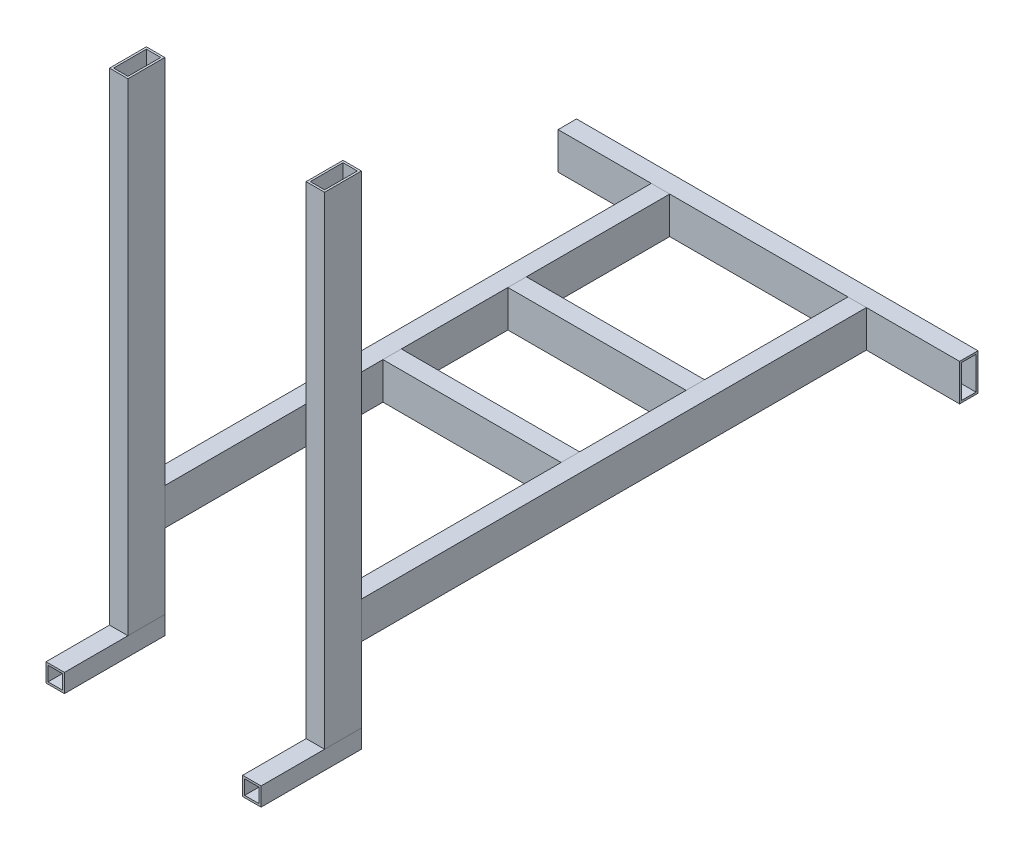
from build123d import *

# Parameters (mm, degrees)
SIGPROFILE_START                    = -45
SIGPROFILE_SIGMA9045_1_DEPTH        = 90
SIGPROFILE_SIGMA9045_1_2_DEPTH      = 5
SIGPROFILE_START_2                  = 40
SIGPROFILE_SIGMA9045_1_3_DEPTH      = 5
SIGPROFILE_SIGMA9045_1_4_DEPTH      = 90
SIGPROFILE_SIGMA9045_1_5_DEPTH      = 5
SIGPROFILE_SIGMA9045_1_6_DEPTH      = 5
SIGPROFILE_SIGMA9045_1_7_OUTLINE_W  = 5
SIGPROFILE_SIGMA9045_1_7_OUTLINE_H  = 1232.5
SIGPROFILE_SIGMA9045_1_7_DEPTH      = 90
SIGPROFILE_SIGMA9045_1_8_OUTLINE_W  = 35
SIGPROFILE_SIGMA9045_1_8_OUTLINE_H  = 1232.5
SIGPROFILE_SIGMA9045_1_8_DEPTH      = 5
SIGPROFILE_SIGMA9045_1_9_OUTLINE_W  = 35
SIGPROFILE_SIGMA9045_1_9_OUTLINE_H  = 1232.5
SIGPROFILE_SIGMA9045_1_9_DEPTH      = 5
SIGPROFILE_START_3                  = -372.5
SIGPROFILE_SIGMA9045_1_10_OUTLINE_W = 980
SIGPROFILE_SIGMA9045_1_10_OUTLINE_H = 90
SIGPROFILE_SIGMA9045_1_10_DEPTH     = 5
SIGPROFILE_START_4                  = -332.5
SIGPROFILE_SIGMA9045_1_11_OUTLINE_W = 980
SIGPROFILE_SIGMA9045_1_11_OUTLINE_H = 90
SIGPROFILE_SIGMA9045_1_11_DEPTH     = 5
SIGPROFILE_START_5                  = -367.5
SIGPROFILE_SIGMA9045_1_12_OUTLINE_W = 980
SIGPROFILE_SIGMA9045_1_12_OUTLINE_H = 5
SIGPROFILE_SIGMA9045_1_12_DEPTH     = 35
SIGPROFILE_START_6                  = 217.45670792
SIGPROFILE_SIGMA9045_1_13_OUTLINE_W = 1200
SIGPROFILE_SIGMA9045_1_13_OUTLINE_H = 90
SIGPROFILE_SIGMA9045_1_13_DEPTH     = 5
SIGPROFILE_START_7                  = 257.45670792
SIGPROFILE_SIGMA9045_1_14_OUTLINE_W = 1200
SIGPROFILE_SIGMA9045_1_14_OUTLINE_H = 90
SIGPROFILE_SIGMA9045_1_14_DEPTH     = 5
SIGPROFILE_START_8                  = 222.45670792
SIGPROFILE_SIGMA9045_1_15_OUTLINE_W = 1200
SIGPROFILE_SIGMA9045_1_15_OUTLINE_H = 5
SIGPROFILE_SIGMA9045_1_15_DEPTH     = 35
SIGPROFILE_START_9                  = -262.5
SIGPROFILE_SIGMA9045_1_16_OUTLINE_W = 1200
SIGPROFILE_SIGMA9045_1_16_OUTLINE_H = 90
SIGPROFILE_SIGMA9045_1_16_DEPTH     = 5
SIGPROFILE_START_10                 = -222.5
SIGPROFILE_SIGMA9045_1_17_OUTLINE_W = 1200
SIGPROFILE_SIGMA9045_1_17_OUTLINE_H = 90
SIGPROFILE_SIGMA9045_1_17_DEPTH     = 5
SIGPROFILE_START_11                 = -257.5
SIGPROFILE_SIGMA9045_1_18_OUTLINE_W = 1200
SIGPROFILE_SIGMA9045_1_18_OUTLINE_H = 5
SIGPROFILE_SIGMA9045_1_18_DEPTH     = 35
SIGPROFILE_SIGMA9045_1_19_DEPTH     = 90
SIGPROFILE_SIGMA9045_1_20_DEPTH     = 5
SIGPROFILE_SIGMA9045_1_21_DEPTH     = 5
SKETCH11_W                          = 45
SKETCH11_H                          = 45
SKETCH11_W_2                        = 35
SKETCH11_H_2                        = 35
SIGPROFILE_SIGMA4545LIGHT_1_DEPTH   = 200
SKETCH11_ON_SEGMENT_2_W             = 45
SKETCH11_ON_SEGMENT_2_H             = 45
SKETCH11_ON_SEGMENT_2_W_2           = 35
SKETCH11_ON_SEGMENT_2_H_2           = 35
SIGPROFILE_SIGMA4545LIGHT_1_2_DEPTH = 200
BODY_8_RUN_ON_DEPTH                 = 45
BODY_9_RUN_ON_DEPTH                 = 44.999999


# Read off the part's stored shape, not the designer's step: Sigprofile SIGMA9045(1)
with BuildPart() as part:
    # Sigprofile SIGMA9045(1) outline → Sigprofile SIGMA9045(1) (new body)
    with BuildSketch(Plane(origin=(0, 0, 0), x_dir=(1, 0, 0), z_dir=(0, 1, 0)).offset(SIGPROFILE_START)):
        Polygon((217.477438166, -327.5), (-217.5, -327.5), (-217.5, -332.5), (217.477271658, -332.5), align=None)
        Polygon((217.476106102, -367.5), (-217.5, -367.5), (-217.5, -372.5), (217.475939594, -372.5), align=None)
    extrude(amount=SIGPROFILE_SIGMA9045_1_DEPTH)

    # Sigprofile SIGMA9045_1 2 outline → Sigprofile SIGMA9045_1 2 (add)
    with BuildSketch(Plane(origin=(0, 0, 0), x_dir=(1, 0, 0), z_dir=(0, 1, 0)).offset(SIGPROFILE_START)):
        Polygon((217.477271658, -332.5), (-217.5, -332.5), (-217.5, -367.5), (217.476106102, -367.5), align=None)
    extrude(amount=SIGPROFILE_SIGMA9045_1_2_DEPTH)

    # Sigprofile SIGMA9045_1 3 outline → Sigprofile SIGMA9045_1 3 (add)
    with BuildSketch(Plane(origin=(0, 0, 0), x_dir=(1, 0, 0), z_dir=(0, 1, 0)).offset(SIGPROFILE_START_2)):
        Polygon((217.477271658, -332.5), (-217.5, -332.5), (-217.5, -367.5), (217.476106102, -367.5), align=None)
    extrude(amount=SIGPROFILE_SIGMA9045_1_3_DEPTH)


with BuildPart() as body_2:
    # Sigprofile SIGMA9045_1 4 outline → Sigprofile SIGMA9045_1 4 (new body)
    with BuildSketch(Plane(origin=(0, 0, 0), x_dir=(1, 0, 0), z_dir=(0, 1, 0)).offset(SIGPROFILE_START)):
        Polygon((217.486096582, -67.5), (217.48626309, -62.5), (-217.5, -62.5), (-217.5, -67.5), align=None)
        Polygon((-217.5, -27.5), (217.487428646, -27.5), (217.487595154, -22.5), (-217.5, -22.5), align=None)
    extrude(amount=SIGPROFILE_SIGMA9045_1_4_DEPTH)

    # Sigprofile SIGMA9045_1 5 outline → Sigprofile SIGMA9045_1 5 (add)
    with BuildSketch(Plane(origin=(0, 0, 0), x_dir=(1, 0, 0), z_dir=(0, 1, 0)).offset(SIGPROFILE_START)):
        Polygon((-217.5, -62.5), (217.48626309, -62.5), (217.487428646, -27.5), (-217.5, -27.5), align=None)
    extrude(amount=SIGPROFILE_SIGMA9045_1_5_DEPTH)

    # Sigprofile SIGMA9045_1 6 outline → Sigprofile SIGMA9045_1 6 (add)
    with BuildSketch(Plane(origin=(0, 0, 0), x_dir=(1, 0, 0), z_dir=(0, 1, 0)).offset(SIGPROFILE_START_2)):
        Polygon((-217.5, -62.5), (217.48626309, -62.5), (217.487428646, -27.5), (-217.5, -27.5), align=None)
    extrude(amount=SIGPROFILE_SIGMA9045_1_6_DEPTH)


with BuildPart() as body_3:
    # Sigprofile SIGMA9045_1 7 outline → Sigprofile SIGMA9045_1 7 (new body)
    with BuildSketch(Plane(origin=(0, 0, 0), x_dir=(1, 0, 0), z_dir=(0, 1, 0)).offset(SIGPROFILE_START)):
        with Locations((-220, -288.75)):
            Rectangle(SIGPROFILE_SIGMA9045_1_7_OUTLINE_W, SIGPROFILE_SIGMA9045_1_7_OUTLINE_H)
        with Locations((-260, -288.75)):
            Rectangle(SIGPROFILE_SIGMA9045_1_7_OUTLINE_W, SIGPROFILE_SIGMA9045_1_7_OUTLINE_H)
    extrude(amount=SIGPROFILE_SIGMA9045_1_7_DEPTH)

    # Sigprofile SIGMA9045_1 8 outline → Sigprofile SIGMA9045_1 8 (add)
    with BuildSketch(Plane(origin=(0, 0, 0), x_dir=(1, 0, 0), z_dir=(0, 1, 0)).offset(SIGPROFILE_START)):
        with Locations((-240, -288.75)):
            Rectangle(SIGPROFILE_SIGMA9045_1_8_OUTLINE_W, SIGPROFILE_SIGMA9045_1_8_OUTLINE_H)
    extrude(amount=SIGPROFILE_SIGMA9045_1_8_DEPTH)

    # Sigprofile SIGMA9045_1 9 outline → Sigprofile SIGMA9045_1 9 (add)
    with BuildSketch(Plane(origin=(0, 0, 0), x_dir=(1, 0, 0), z_dir=(0, 1, 0)).offset(SIGPROFILE_START_2)):
        with Locations((-240, -288.75)):
            Rectangle(SIGPROFILE_SIGMA9045_1_9_OUTLINE_W, SIGPROFILE_SIGMA9045_1_9_OUTLINE_H)
    extrude(amount=SIGPROFILE_SIGMA9045_1_9_DEPTH)


with BuildPart() as body_4:
    # Sigprofile SIGMA9045_1 10 outline → Sigprofile SIGMA9045_1 10 (new body)
    with BuildSketch(Plane.XY.offset(SIGPROFILE_START_3)):
        Rectangle(SIGPROFILE_SIGMA9045_1_10_OUTLINE_W, SIGPROFILE_SIGMA9045_1_10_OUTLINE_H)
    extrude(amount=SIGPROFILE_SIGMA9045_1_10_DEPTH)

    # Sigprofile SIGMA9045_1 11 outline → Sigprofile SIGMA9045_1 11 (add)
    with BuildSketch(Plane.XY.offset(SIGPROFILE_START_4)):
        Rectangle(SIGPROFILE_SIGMA9045_1_11_OUTLINE_W, SIGPROFILE_SIGMA9045_1_11_OUTLINE_H)
    extrude(amount=SIGPROFILE_SIGMA9045_1_11_DEPTH)

    # Sigprofile SIGMA9045_1 12 outline → Sigprofile SIGMA9045_1 12 (add)
    with BuildSketch(Plane.XY.offset(SIGPROFILE_START_5)):
        with Locations((0, 42.5)):
            Rectangle(SIGPROFILE_SIGMA9045_1_12_OUTLINE_W, SIGPROFILE_SIGMA9045_1_12_OUTLINE_H)
        with Locations((0, -42.5)):
            Rectangle(SIGPROFILE_SIGMA9045_1_12_OUTLINE_W, SIGPROFILE_SIGMA9045_1_12_OUTLINE_H)
    extrude(amount=SIGPROFILE_SIGMA9045_1_12_DEPTH)


with BuildPart() as body_5:
    # Sigprofile SIGMA9045_1 13 outline → Sigprofile SIGMA9045_1 13 (new body)
    with BuildSketch(Plane.YZ.offset(SIGPROFILE_START_6)):
        with Locations((350.000005857, 949.999999279)):
            Rectangle(SIGPROFILE_SIGMA9045_1_13_OUTLINE_W, SIGPROFILE_SIGMA9045_1_13_OUTLINE_H)
    extrude(amount=SIGPROFILE_SIGMA9045_1_13_DEPTH)

    # Sigprofile SIGMA9045_1 14 outline → Sigprofile SIGMA9045_1 14 (add)
    with BuildSketch(Plane.YZ.offset(SIGPROFILE_START_7)):
        with Locations((350.000005857, 949.999999279)):
            Rectangle(SIGPROFILE_SIGMA9045_1_14_OUTLINE_W, SIGPROFILE_SIGMA9045_1_14_OUTLINE_H)
    extrude(amount=SIGPROFILE_SIGMA9045_1_14_DEPTH)

    # Sigprofile SIGMA9045_1 15 outline → Sigprofile SIGMA9045_1 15 (add)
    with BuildSketch(Plane.YZ.offset(SIGPROFILE_START_8)):
        with Locations((350.000005857, 907.499999279)):
            Rectangle(SIGPROFILE_SIGMA9045_1_15_OUTLINE_W, SIGPROFILE_SIGMA9045_1_15_OUTLINE_H)
        with Locations((350.000005857, 992.499999279)):
            Rectangle(SIGPROFILE_SIGMA9045_1_15_OUTLINE_W, SIGPROFILE_SIGMA9045_1_15_OUTLINE_H)
    extrude(amount=SIGPROFILE_SIGMA9045_1_15_DEPTH)

    # Trim/Extend3
    split(bisect_by=Plane(origin=(-240, -227.5, 1050), x_dir=(-1, 0, 0), z_dir=(0, 1, 0)), keep=Keep.TOP)


with BuildPart() as body_6:
    # Sigprofile SIGMA9045_1 16 outline → Sigprofile SIGMA9045_1 16 (new body)
    with BuildSketch(Plane.YZ.offset(SIGPROFILE_START_9)):
        with Locations((350, 950)):
            Rectangle(SIGPROFILE_SIGMA9045_1_16_OUTLINE_W, SIGPROFILE_SIGMA9045_1_16_OUTLINE_H)
    extrude(amount=SIGPROFILE_SIGMA9045_1_16_DEPTH)

    # Sigprofile SIGMA9045_1 17 outline → Sigprofile SIGMA9045_1 17 (add)
    with BuildSketch(Plane.YZ.offset(SIGPROFILE_START_10)):
        with Locations((350, 950)):
            Rectangle(SIGPROFILE_SIGMA9045_1_17_OUTLINE_W, SIGPROFILE_SIGMA9045_1_17_OUTLINE_H)
    extrude(amount=SIGPROFILE_SIGMA9045_1_17_DEPTH)

    # Sigprofile SIGMA9045_1 18 outline → Sigprofile SIGMA9045_1 18 (add)
    with BuildSketch(Plane.YZ.offset(SIGPROFILE_START_11)):
        with Locations((350, 907.5)):
            Rectangle(SIGPROFILE_SIGMA9045_1_18_OUTLINE_W, SIGPROFILE_SIGMA9045_1_18_OUTLINE_H)
        with Locations((350, 992.5)):
            Rectangle(SIGPROFILE_SIGMA9045_1_18_OUTLINE_W, SIGPROFILE_SIGMA9045_1_18_OUTLINE_H)
    extrude(amount=SIGPROFILE_SIGMA9045_1_18_DEPTH)

    # Trim/Extend3
    split(bisect_by=Plane(origin=(-240, -227.5, 1050), x_dir=(-1, 0, 0), z_dir=(0, 1, 0)), keep=Keep.TOP)


with BuildPart() as body_7:
    # Sigprofile SIGMA9045_1 19 outline → Sigprofile SIGMA9045_1 19 (new body)
    with BuildSketch(Plane(origin=(0, 0, 0), x_dir=(1, 0, 0), z_dir=(0, 1, 0)).offset(SIGPROFILE_START)):
        Polygon((217.455209348, -994.999999279), (222.455209348, -994.999999279), (222.499250714, 327.5), (217.499250714, 327.5), align=None)
        Polygon((257.499250714, 327.5), (257.455209348, -994.999999279), (262.455209348, -994.999999279), (262.499250714, 327.5), align=None)
    extrude(amount=SIGPROFILE_SIGMA9045_1_19_DEPTH)

    # Sigprofile SIGMA9045_1 20 outline → Sigprofile SIGMA9045_1 20 (add)
    with BuildSketch(Plane(origin=(0, 0, 0), x_dir=(1, 0, 0), z_dir=(0, 1, 0)).offset(SIGPROFILE_START)):
        Polygon((222.499250714, 327.5), (222.455209348, -994.999999279), (257.455209348, -994.999999279), (257.499250714, 327.5), align=None)
    extrude(amount=SIGPROFILE_SIGMA9045_1_20_DEPTH)

    # Sigprofile SIGMA9045_1 21 outline → Sigprofile SIGMA9045_1 21 (add)
    with BuildSketch(Plane(origin=(0, 0, 0), x_dir=(1, 0, 0), z_dir=(0, 1, 0)).offset(SIGPROFILE_START_2)):
        Polygon((222.499250714, 327.5), (222.455209348, -994.999999279), (257.455209348, -994.999999279), (257.499250714, 327.5), align=None)
    extrude(amount=SIGPROFILE_SIGMA9045_1_21_DEPTH)

    # Trim/Extend2
    split(bisect_by=Plane(origin=(-240, 350, 905), x_dir=(0, 1, 0), z_dir=(0, 0, -1)), keep=Keep.TOP)


with BuildPart() as body_8:
    # Sketch11 → Sigprofile SIGMA4545LIGHT(1) (new body)
    with BuildSketch(Plane(origin=(-240, -250, 950), x_dir=(1, 0, 0), z_dir=(0, 0, 1))):
        Rectangle(SKETCH11_W, SKETCH11_H)
        Rectangle(SKETCH11_W_2, SKETCH11_H_2, mode=Mode.SUBTRACT)
    extrude(amount=SIGPROFILE_SIGMA4545LIGHT_1_DEPTH)

    # Sketch11 → body 8 run on (add)
    with BuildSketch(Plane(origin=(-240, -250, 950), x_dir=(1, 0, 0), z_dir=(0, 0, 1))):
        Rectangle(SKETCH11_W, SKETCH11_H)
        Rectangle(SKETCH11_W_2, SKETCH11_H_2, mode=Mode.SUBTRACT)
    extrude(amount=-BODY_8_RUN_ON_DEPTH)


with BuildPart() as body_9:
    # Sketch11 on segment 2 (carried to segment 2) → Sigprofile SIGMA4545LIGHT_1 2 (new body)
    with BuildSketch(Plane(origin=(239.95670792, -249.999994143, 949.999999279), x_dir=(1, 0, 0), z_dir=(0, 0, 1))):
        Rectangle(SKETCH11_ON_SEGMENT_2_W, SKETCH11_ON_SEGMENT_2_H)
        Rectangle(SKETCH11_ON_SEGMENT_2_W_2, SKETCH11_ON_SEGMENT_2_H_2, mode=Mode.SUBTRACT)
    extrude(amount=SIGPROFILE_SIGMA4545LIGHT_1_2_DEPTH)

    # Sketch11 on segment 2 (carried to segment 2) → body 9 run on (add)
    with BuildSketch(Plane(origin=(239.95670792, -249.999994143, 949.999999279), x_dir=(1, 0, 0), z_dir=(0, 0, 1))):
        Rectangle(SKETCH11_ON_SEGMENT_2_W, SKETCH11_ON_SEGMENT_2_H)
        Rectangle(SKETCH11_ON_SEGMENT_2_W_2, SKETCH11_ON_SEGMENT_2_H_2, mode=Mode.SUBTRACT)
    extrude(amount=-BODY_9_RUN_ON_DEPTH)


solid = Compound([part.part, body_2.part, body_3.part, body_4.part, body_5.part, body_6.part, body_7.part, body_8.part, body_9.part])
